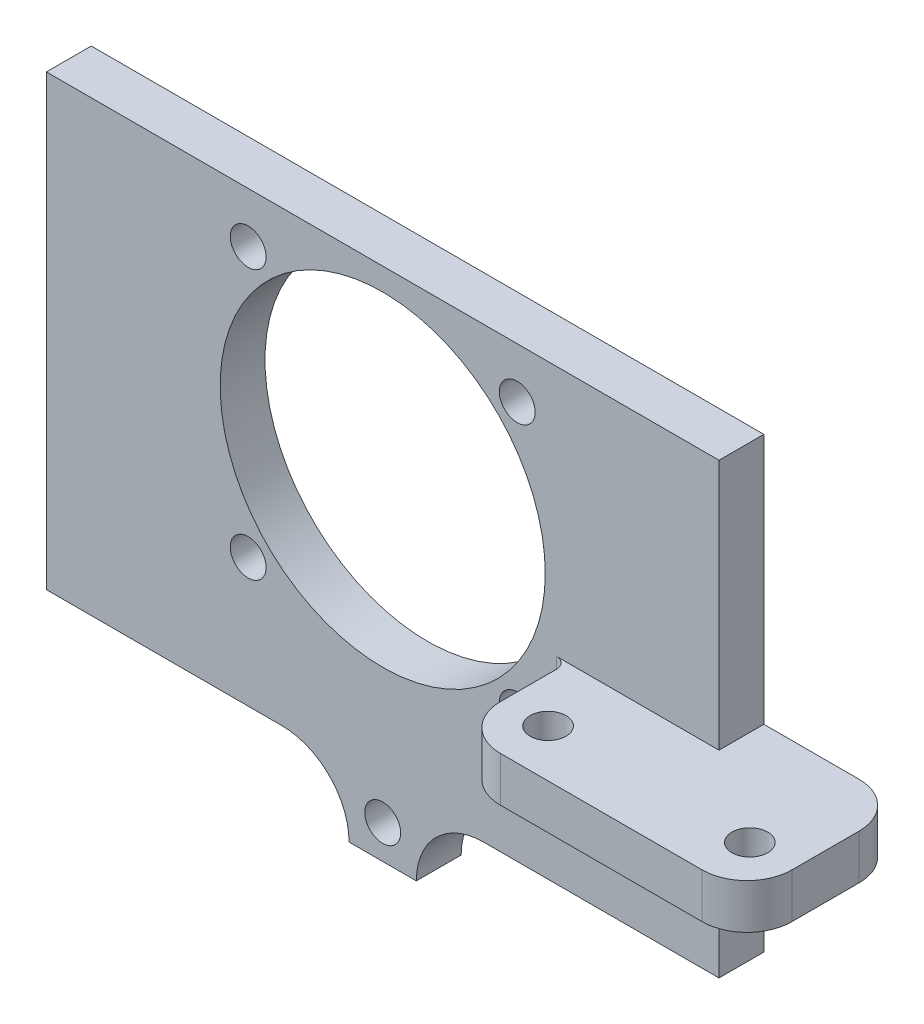
from build123d import *

# Parameters (mm, degrees)
SKETCH1_W                  = 60
SKETCH1_H                  = 40
BOSS_EXTRUDE1_DEPTH        = 4
SKETCH4_R                  = 14.5
CUT_EXTRUDE1_DEPTH         = 4
SKETCH6_R                  = 1.6
CUT_EXTRUDE2_DEPTH         = 4
SKETCH7_W                  = 26
SKETCH7_H                  = 4
BOSS_EXTRUDE3_DEPTH        = 10
SKETCH8_R                  = 1.6
CUT_EXTRUDE3_DEPTH         = 78.162231694
SKETCH9_W                  = 4
SKETCH9_H                  = 4
BOSS_EXTRUDE4_DEPTH        = 12.5
FILLET2_R                  = 4
FILLET3_R                  = 1
SKETCH10_W                 = 6
SKETCH10_H                 = 4
BOSS_EXTRUDE5_DEPTH        = 6
FILLET4_R                  = 6
F_3_2_3_2_DIAMETER_HOLE1_D = 3.2


with BuildPart() as part:
    # Sketch1 → Boss-Extrude1 (new body)
    with BuildSketch(Plane.XY):
        with Locations((30, 20)):
            Rectangle(SKETCH1_W, SKETCH1_H)
    extrude(amount=BOSS_EXTRUDE1_DEPTH)

    # Sketch4 → Cut-Extrude1 (cut)
    with BuildSketch(Plane.XY.offset(4)):
        with Locations((30, 23.5)):
            Circle(SKETCH4_R)
    extrude(amount=-CUT_EXTRUDE1_DEPTH, mode=Mode.SUBTRACT)

    # Sketch6 → Cut-Extrude2 (cut)
    with BuildSketch(Plane.XY.offset(4)):
        with Locations((42, 11.5)):
            Circle(SKETCH6_R)
        with Locations((18, 11.5)):
            Circle(SKETCH6_R)
        with Locations((18, 35.5)):
            Circle(SKETCH6_R)
        with Locations((42, 35.5)):
            Circle(SKETCH6_R)
    extrude(amount=-CUT_EXTRUDE2_DEPTH, mode=Mode.SUBTRACT)

    # Sketch7 → Boss-Extrude3 (add)
    with BuildSketch(Plane.XY.offset(4)):
        with Locations((59.5, 15.6)):
            Rectangle(SKETCH7_W, SKETCH7_H)
    extrude(amount=BOSS_EXTRUDE3_DEPTH)

    # Sketch8 → Cut-Extrude3 (cut, through all)
    with BuildSketch(Plane(origin=(0, 17.6, 0), x_dir=(1, 0, 0), z_dir=(0, 1, 0))):
        with Locations(Location((68.5, -9.75, 0), (0, 0, 270))):
            Circle(SKETCH8_R)
        with Locations(Location((50.5, -9.75, 0), (0, 0, 270))):
            Circle(SKETCH8_R)
    extrude(amount=-CUT_EXTRUDE3_DEPTH, mode=Mode.SUBTRACT)

    # Sketch9 → Boss-Extrude4 (add)
    with BuildSketch(Plane(origin=(60, 0, 0), x_dir=(0, 0, -1), z_dir=(1, 0, 0))):
        with Locations((-2, 15.6)):
            Rectangle(SKETCH9_W, SKETCH9_H)
    extrude(amount=BOSS_EXTRUDE4_DEPTH)

    # Fillet2
    fillet2_edges = [part.edges().sort_by_distance(p)[0] for p in [
        (46.5, 15.6, 14),
        (72.5, 15.6, 14),
        (72.5, 15.6, 0),
    ]]
    fillet(fillet2_edges, radius=FILLET2_R)

    # Fillet3
    fillet3_edges = [part.edges().sort_by_distance(p)[0] for p in [
        (46.5, 15.6, 4),
        (53.25, 13.6, 4),
        (60, 13.6, 2),
    ]]
    fillet(fillet3_edges, radius=FILLET3_R)

    # Sketch10 → Boss-Extrude5 (add)
    with BuildSketch(Plane.XZ):
        with Locations((30, 2)):
            Rectangle(SKETCH10_W, SKETCH10_H)
    extrude(amount=BOSS_EXTRUDE5_DEPTH)

    # Fillet4
    fillet4_edges = [part.edges().sort_by_distance(p)[0] for p in [
        (27, 0, 2),
        (33, 0, 2),
    ]]
    fillet(fillet4_edges, radius=FILLET4_R - 0.0001)  # a hair under: the kernel refuses the full size

    # Ø3.2 (3.2) Diameter Hole1 (through all)
    with Locations(Plane.XY.offset(4)):
        with Locations((30, -3)):
            Hole(F_3_2_3_2_DIAMETER_HOLE1_D / 2)


solid = part.part
